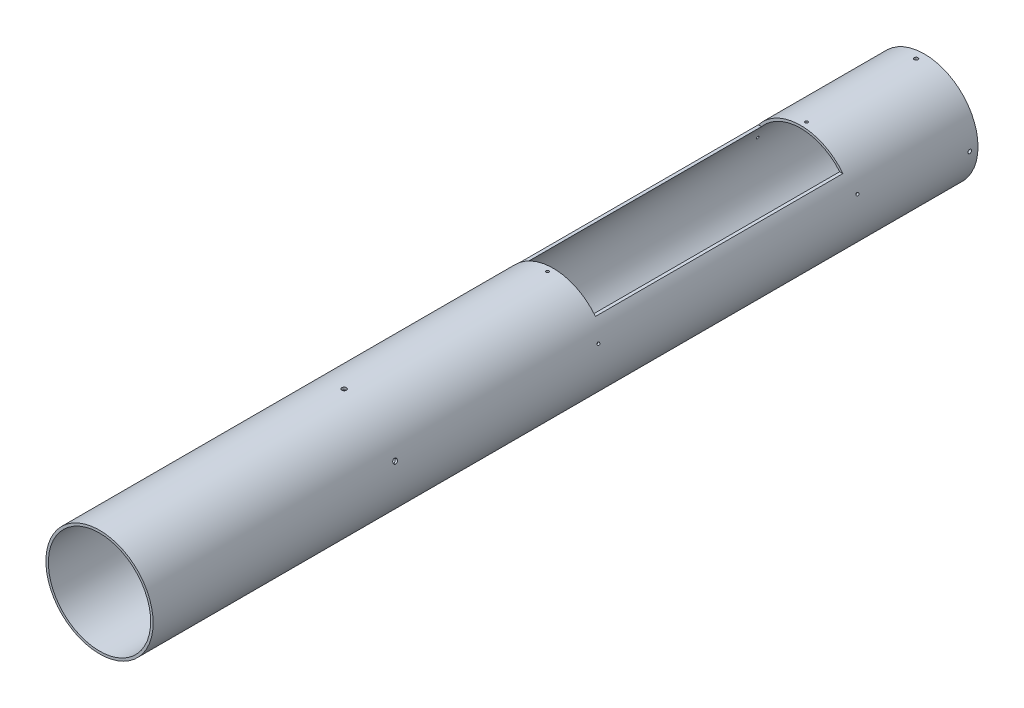
from build123d import *

# Parameters (mm, degrees)
SKETCH1_R                          = 65
SKETCH1_R_2                        = 62
BOSS_EXTRUDE1_DEPTH                = 1000
SKETCH4_W                          = 130
SKETCH4_H                          = 300
CUT_EXTRUDE4_DEPTH                 = 516
M4_CLEARANCE_HOLE2_D               = 4.5
M4_CLEARANCE_HOLE2_ON_FACE_2_D     = 4.5
M4_CLEARANCE_HOLE2_ON_FACE_3_D     = 4.5
M4_CLEARANCE_HOLE2_ON_FACE_4_D     = 4.5
M3_CLEARANCE_HOLE1_REACH           = 871.238
M3_CLEARANCE_HOLE1_BORE_R          = 1.7
M3_CLEARANCE_HOLE1_ON_FACE_2_REACH = 872.501
M3_CLEARANCE_HOLE1_BORE_2_R        = 1.7
M3_CLEARANCE_HOLE1_ON_FACE_3_REACH = 873.164
M3_CLEARANCE_HOLE1_BORE_3_R        = 1.7
M3_CLEARANCE_HOLE1_ON_FACE_4_REACH = 873.164
M3_CLEARANCE_HOLE1_BORE_4_R        = 1.7
M3_CLEARANCE_HOLE1_ON_FACE_5_REACH = 872.501
M3_CLEARANCE_HOLE1_BORE_5_R        = 1.7
M5_CLEARANCE_HOLE1_REACH           = 721.885
M5_CLEARANCE_HOLE1_BORE_R          = 2.75
M5_CLEARANCE_HOLE1_ON_FACE_2_REACH = 722.687
M5_CLEARANCE_HOLE1_BORE_2_R        = 2.75
M5_CLEARANCE_HOLE1_ON_FACE_3_REACH = 722.687
M5_CLEARANCE_HOLE1_BORE_3_R        = 2.75
M5_CLEARANCE_HOLE1_ON_FACE_4_REACH = 721.885
M5_CLEARANCE_HOLE1_BORE_4_R        = 2.75
M5_CLEARANCE_HOLE1_ON_FACE_5_REACH = 720.357
M5_CLEARANCE_HOLE1_BORE_5_R        = 2.75
CUT_EXTRUDE8_START                 = -103
CUT_EXTRUDE8_DEPTH                 = 103


with BuildPart() as part:
    # Sketch1 → Boss-Extrude1 (new body)
    with BuildSketch(Plane.XY):
        Circle(SKETCH1_R)
        Circle(SKETCH1_R_2, mode=Mode.SUBTRACT)
    extrude(amount=BOSS_EXTRUDE1_DEPTH)

    # Sketch4 → Cut-Extrude4 (cut)
    with BuildSketch(Plane(origin=(0, 40, 0), x_dir=(1, 0, 0), z_dir=(0, 1, 0))):
        with Locations((0, -300)):
            Rectangle(SKETCH4_W, SKETCH4_H)
    extrude(amount=CUT_EXTRUDE4_DEPTH, mode=Mode.SUBTRACT)

    # M4 Clearance Hole2 (through all)
    with Locations(Plane(origin=(0, 65, 10), x_dir=(1, 0, 0), z_dir=(0, 1, 0))):
        with Locations((0, 0)):
            Hole(M4_CLEARANCE_HOLE2_D / 2)

    # M4 Clearance Hole2 on face 2 (through all)
    with Locations(Plane(origin=(65, 0, 10), x_dir=(0, 0, 1), z_dir=(1, 0, 0))):
        with Locations((0, 0)):
            Hole(M4_CLEARANCE_HOLE2_ON_FACE_2_D / 2)

    # M4 Clearance Hole2 on face 3 (through all)
    with Locations(Plane(origin=(0, -65, 10), x_dir=(0, 0, -1), z_dir=(0, -1, 0))):
        with Locations((0, 0)):
            Hole(M4_CLEARANCE_HOLE2_ON_FACE_3_D / 2)

    # M4 Clearance Hole2 on face 4 (through all)
    with Locations(Plane(origin=(-65, 0, 10), x_dir=(0, 0, -1), z_dir=(-1, 0, 0))):
        with Locations((0, 0)):
            Hole(M4_CLEARANCE_HOLE2_ON_FACE_4_D / 2)

    # M3 Clearance Hole1 bore (on position points) → M3 Clearance Hole1 (cut, up to next)
    with BuildSketch(Plane(origin=(0, 65, 143), x_dir=(1, 0, 0), z_dir=(0, 1, 0)), mode=Mode.PRIVATE) as m3_clearance_hole1_sk1:
        Circle(M3_CLEARANCE_HOLE1_BORE_R)
    m3_clearance_hole1_tool1 = extrude(m3_clearance_hole1_sk1.sketch, amount=-M3_CLEARANCE_HOLE1_REACH, mode=Mode.PRIVATE) & part.part
    # M3 Clearance Hole1 bore (on position points) → M3 Clearance Hole1 (cut, up to next)
    with BuildSketch(Plane(origin=(0, 65, 143), x_dir=(1, 0, 0), z_dir=(0, 1, 0)), mode=Mode.PRIVATE) as m3_clearance_hole1_sk2:
        with Locations((0, -314)):
            Circle(M3_CLEARANCE_HOLE1_BORE_R)
    m3_clearance_hole1_tool2 = extrude(m3_clearance_hole1_sk2.sketch, amount=-M3_CLEARANCE_HOLE1_REACH, mode=Mode.PRIVATE) & part.part
    add(m3_clearance_hole1_tool1.solids().sort_by_distance((0, 65, 143))[0], mode=Mode.SUBTRACT)
    add(m3_clearance_hole1_tool2.solids().sort_by_distance((0, 65, 457))[0], mode=Mode.SUBTRACT)

    # M3 Clearance Hole1 bore 2 (on position points) → M3 Clearance Hole1 on face 2 (cut, up to next)
    with BuildSketch(Plane(origin=(61.818673559, 20.086104634, 143), x_dir=(-0.309016857306, 0.951056560832, 0), z_dir=(0.951056560832, 0.309016857306, 0)), mode=Mode.PRIVATE) as m3_clearance_hole1_on_face_2_sk1:
        Circle(M3_CLEARANCE_HOLE1_BORE_2_R)
    m3_clearance_hole1_on_face_2_tool1 = extrude(m3_clearance_hole1_on_face_2_sk1.sketch, amount=-M3_CLEARANCE_HOLE1_ON_FACE_2_REACH, mode=Mode.PRIVATE) & part.part
    # M3 Clearance Hole1 bore 2 (on position points) → M3 Clearance Hole1 on face 2 (cut, up to next)
    with BuildSketch(Plane(origin=(61.818673559, 20.086104634, 143), x_dir=(-0.309016857306, 0.951056560832, 0), z_dir=(0.951056560832, 0.309016857306, 0)), mode=Mode.PRIVATE) as m3_clearance_hole1_on_face_2_sk2:
        with Locations((0, 314)):
            Circle(M3_CLEARANCE_HOLE1_BORE_2_R)
    m3_clearance_hole1_on_face_2_tool2 = extrude(m3_clearance_hole1_on_face_2_sk2.sketch, amount=-M3_CLEARANCE_HOLE1_ON_FACE_2_REACH, mode=Mode.PRIVATE) & part.part
    add(m3_clearance_hole1_on_face_2_tool1.solids().sort_by_distance((61.818674, 20.086105, 143))[0], mode=Mode.SUBTRACT)
    add(m3_clearance_hole1_on_face_2_tool2.solids().sort_by_distance((61.818674, 20.086105, 457))[0], mode=Mode.SUBTRACT)

    # M3 Clearance Hole1 bore 3 (on position points) → M3 Clearance Hole1 on face 3 (cut, up to next)
    with BuildSketch(Plane(origin=(38.206041399, -52.586104634, 143), x_dir=(-0.809017116291, -0.58778508449, 0), z_dir=(0.58778508449, -0.809017116291, 0)), mode=Mode.PRIVATE) as m3_clearance_hole1_on_face_3_sk1:
        Circle(M3_CLEARANCE_HOLE1_BORE_3_R)
    m3_clearance_hole1_on_face_3_tool1 = extrude(m3_clearance_hole1_on_face_3_sk1.sketch, amount=-M3_CLEARANCE_HOLE1_ON_FACE_3_REACH, mode=Mode.PRIVATE) & part.part
    # M3 Clearance Hole1 bore 3 (on position points) → M3 Clearance Hole1 on face 3 (cut, up to next)
    with BuildSketch(Plane(origin=(38.206041399, -52.586104634, 143), x_dir=(-0.809017116291, -0.58778508449, 0), z_dir=(0.58778508449, -0.809017116291, 0)), mode=Mode.PRIVATE) as m3_clearance_hole1_on_face_3_sk2:
        with Locations((0, -314)):
            Circle(M3_CLEARANCE_HOLE1_BORE_3_R)
    m3_clearance_hole1_on_face_3_tool2 = extrude(m3_clearance_hole1_on_face_3_sk2.sketch, amount=-M3_CLEARANCE_HOLE1_ON_FACE_3_REACH, mode=Mode.PRIVATE) & part.part
    add(m3_clearance_hole1_on_face_3_tool1.solids().sort_by_distance((38.206041, -52.586105, 143))[0], mode=Mode.SUBTRACT)
    add(m3_clearance_hole1_on_face_3_tool2.solids().sort_by_distance((38.206041, -52.586105, 457))[0], mode=Mode.SUBTRACT)

    # M3 Clearance Hole1 bore 4 (on position points) → M3 Clearance Hole1 on face 4 (cut, up to next)
    with BuildSketch(Plane(origin=(-38.206041399, -52.586104634, 143), x_dir=(-0.809017116291, 0.58778508449, 0), z_dir=(-0.58778508449, -0.809017116291, 0)), mode=Mode.PRIVATE) as m3_clearance_hole1_on_face_4_sk1:
        Circle(M3_CLEARANCE_HOLE1_BORE_4_R)
    m3_clearance_hole1_on_face_4_tool1 = extrude(m3_clearance_hole1_on_face_4_sk1.sketch, amount=-M3_CLEARANCE_HOLE1_ON_FACE_4_REACH, mode=Mode.PRIVATE) & part.part
    # M3 Clearance Hole1 bore 4 (on position points) → M3 Clearance Hole1 on face 4 (cut, up to next)
    with BuildSketch(Plane(origin=(-38.206041399, -52.586104634, 143), x_dir=(-0.809017116291, 0.58778508449, 0), z_dir=(-0.58778508449, -0.809017116291, 0)), mode=Mode.PRIVATE) as m3_clearance_hole1_on_face_4_sk2:
        with Locations((0, -314)):
            Circle(M3_CLEARANCE_HOLE1_BORE_4_R)
    m3_clearance_hole1_on_face_4_tool2 = extrude(m3_clearance_hole1_on_face_4_sk2.sketch, amount=-M3_CLEARANCE_HOLE1_ON_FACE_4_REACH, mode=Mode.PRIVATE) & part.part
    add(m3_clearance_hole1_on_face_4_tool1.solids().sort_by_distance((-38.206041, -52.586105, 143))[0], mode=Mode.SUBTRACT)
    add(m3_clearance_hole1_on_face_4_tool2.solids().sort_by_distance((-38.206041, -52.586105, 457))[0], mode=Mode.SUBTRACT)

    # M3 Clearance Hole1 bore 5 (on position points) → M3 Clearance Hole1 on face 5 (cut, up to next)
    with BuildSketch(Plane(origin=(-61.818673559, 20.086104634, 143), x_dir=(-0.309016857306, -0.951056560832, 0), z_dir=(-0.951056560832, 0.309016857306, 0)), mode=Mode.PRIVATE) as m3_clearance_hole1_on_face_5_sk1:
        Circle(M3_CLEARANCE_HOLE1_BORE_5_R)
    m3_clearance_hole1_on_face_5_tool1 = extrude(m3_clearance_hole1_on_face_5_sk1.sketch, amount=-M3_CLEARANCE_HOLE1_ON_FACE_5_REACH, mode=Mode.PRIVATE) & part.part
    # M3 Clearance Hole1 bore 5 (on position points) → M3 Clearance Hole1 on face 5 (cut, up to next)
    with BuildSketch(Plane(origin=(-61.818673559, 20.086104634, 143), x_dir=(-0.309016857306, -0.951056560832, 0), z_dir=(-0.951056560832, 0.309016857306, 0)), mode=Mode.PRIVATE) as m3_clearance_hole1_on_face_5_sk2:
        with Locations((0, 314)):
            Circle(M3_CLEARANCE_HOLE1_BORE_5_R)
    m3_clearance_hole1_on_face_5_tool2 = extrude(m3_clearance_hole1_on_face_5_sk2.sketch, amount=-M3_CLEARANCE_HOLE1_ON_FACE_5_REACH, mode=Mode.PRIVATE) & part.part
    add(m3_clearance_hole1_on_face_5_tool1.solids().sort_by_distance((-61.818674, 20.086105, 143))[0], mode=Mode.SUBTRACT)
    add(m3_clearance_hole1_on_face_5_tool2.solids().sort_by_distance((-61.818674, 20.086105, 457))[0], mode=Mode.SUBTRACT)

    # M5 Clearance Hole1 bore (on position points) → M5 Clearance Hole1 (cut, up to next)
    with BuildSketch(Plane(origin=(-61.818673559, 20.086104634, 703.5), x_dir=(-0.309016994375, -0.951056516295, 0), z_dir=(-0.951056516295, 0.309016994375, 0)), mode=Mode.PRIVATE) as m5_clearance_hole1_sk1:
        Circle(M5_CLEARANCE_HOLE1_BORE_R)
    m5_clearance_hole1_tool1 = extrude(m5_clearance_hole1_sk1.sketch, amount=-M5_CLEARANCE_HOLE1_REACH, mode=Mode.PRIVATE) & part.part
    add(m5_clearance_hole1_tool1.solids().sort_by_distance((-61.818674, 20.086105, 703.5))[0], mode=Mode.SUBTRACT)

    # M5 Clearance Hole1 bore 2 (on position points) → M5 Clearance Hole1 on face 2 (cut, up to next)
    with BuildSketch(Plane(origin=(-38.206041399, -52.586104634, 703.5), x_dir=(-0.809017116291, 0.58778508449, 0), z_dir=(-0.58778508449, -0.809017116291, 0)), mode=Mode.PRIVATE) as m5_clearance_hole1_on_face_2_sk1:
        Circle(M5_CLEARANCE_HOLE1_BORE_2_R)
    m5_clearance_hole1_on_face_2_tool1 = extrude(m5_clearance_hole1_on_face_2_sk1.sketch, amount=-M5_CLEARANCE_HOLE1_ON_FACE_2_REACH, mode=Mode.PRIVATE) & part.part
    add(m5_clearance_hole1_on_face_2_tool1.solids().sort_by_distance((-38.206041, -52.586105, 703.5))[0], mode=Mode.SUBTRACT)

    # M5 Clearance Hole1 bore 3 (on position points) → M5 Clearance Hole1 on face 3 (cut, up to next)
    with BuildSketch(Plane(origin=(38.206041399, -52.586104634, 703.5), x_dir=(-0.809017116291, -0.58778508449, 0), z_dir=(0.58778508449, -0.809017116291, 0)), mode=Mode.PRIVATE) as m5_clearance_hole1_on_face_3_sk1:
        Circle(M5_CLEARANCE_HOLE1_BORE_3_R)
    m5_clearance_hole1_on_face_3_tool1 = extrude(m5_clearance_hole1_on_face_3_sk1.sketch, amount=-M5_CLEARANCE_HOLE1_ON_FACE_3_REACH, mode=Mode.PRIVATE) & part.part
    add(m5_clearance_hole1_on_face_3_tool1.solids().sort_by_distance((38.206041, -52.586105, 703.5))[0], mode=Mode.SUBTRACT)

    # M5 Clearance Hole1 bore 4 (on position points) → M5 Clearance Hole1 on face 4 (cut, up to next)
    with BuildSketch(Plane(origin=(61.818673559, 20.086104634, 703.5), x_dir=(-0.309016857306, 0.951056560832, 0), z_dir=(0.951056560832, 0.309016857306, 0)), mode=Mode.PRIVATE) as m5_clearance_hole1_on_face_4_sk1:
        Circle(M5_CLEARANCE_HOLE1_BORE_4_R)
    m5_clearance_hole1_on_face_4_tool1 = extrude(m5_clearance_hole1_on_face_4_sk1.sketch, amount=-M5_CLEARANCE_HOLE1_ON_FACE_4_REACH, mode=Mode.PRIVATE) & part.part
    add(m5_clearance_hole1_on_face_4_tool1.solids().sort_by_distance((61.818674, 20.086105, 703.5))[0], mode=Mode.SUBTRACT)

    # M5 Clearance Hole1 bore 5 (on position points) → M5 Clearance Hole1 on face 5 (cut, up to next)
    with BuildSketch(Plane(origin=(0, 65, 703.5), x_dir=(0, 0, 1), z_dir=(0, 1, 0)), mode=Mode.PRIVATE) as m5_clearance_hole1_on_face_5_sk1:
        Circle(M5_CLEARANCE_HOLE1_BORE_5_R)
    m5_clearance_hole1_on_face_5_tool1 = extrude(m5_clearance_hole1_on_face_5_sk1.sketch, amount=-M5_CLEARANCE_HOLE1_ON_FACE_5_REACH, mode=Mode.PRIVATE) & part.part
    add(m5_clearance_hole1_on_face_5_tool1.solids().sort_by_distance((0, 65, 703.5))[0], mode=Mode.SUBTRACT)

    # Sketch9 → Cut-Extrude8 (cut)
    with BuildSketch(Plane.XY.offset(135).offset(CUT_EXTRUDE8_START)):
        with BuildLine():
            Line((0, 0), (-37.282468363, -53.244882879))
            ThreePointArc((-37.282468363, -53.244882879), (0, -65), (37.282468363, -53.244882879))
            Line((37.282468363, -53.244882879), (0, 0))
        make_face()
    extrude(amount=CUT_EXTRUDE8_DEPTH, mode=Mode.SUBTRACT)


solid = part.part
